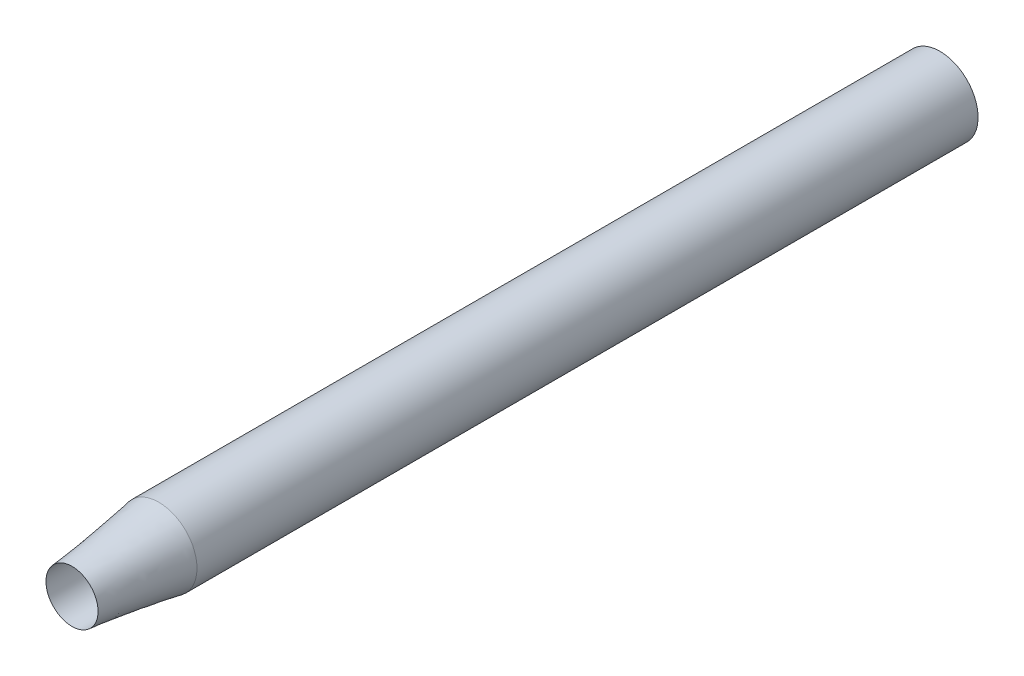
from build123d import *

# Parameters (mm, degrees)
SKETCH1_R           = 2.2
BOSS_EXTRUDE1_DEPTH = 45
SKETCH4_R           = 1.5
CUT_EXTRUDE1_DEPTH  = 51.096706487


with BuildPart() as part:
    # Sketch1 → Boss-Extrude1 (new body)
    with BuildSketch(Plane.XY):
        with Locations(Location((0, 0, 0), (0, 0, 180))):
            Circle(SKETCH1_R)
    extrude(amount=BOSS_EXTRUDE1_DEPTH)

    # Loft1: read off the stored shape, not the designer's step
    # Loft1: loft between two sections, ruled curve by curve
    loft1_from = [
        Edge.make_bspline([(-2.015197815, 0.88259717, 45), (-3.780392156, -3.14779846, 45), (0.250003475, -4.912992801, 45), (2.015197815, -0.88259717, 45), (3.780392156, 3.14779846, 45), (-0.250003475, 4.912992801, 45), (-2.015197815, 0.88259717, 45)], [0, 0, 0, 0, 0.5, 0.5, 0.5, 1, 1, 1, 1], 3, [1, 0.333333333, 0.333333333, 1, 0.333333333, 0.333333333, 1]),
    ]
    loft1_to = [
        Edge.make_bspline([(-1.498749202, -0.061244028, 50), (-1.376261146, -3.058742431, 50), (1.621237257, -2.936254375, 50), (1.498749202, 0.061244028, 50), (1.376261146, 3.058742431, 50), (-1.621237257, 2.936254375, 50), (-1.498749202, -0.061244028, 50)], [0, 0, 0, 0, 0.5, 0.5, 0.5, 1, 1, 1, 1], 3, [1, 0.333333333, 0.333333333, 1, 0.333333333, 0.333333333, 1]),
    ]
    loft1 = Solid(Shell([*[Face.make_surface_from_curves(loft1_from[k], loft1_to[k]) for k in range(1)], Face(Wire(loft1_from)), Face(Wire(loft1_to))]))
    add(loft1)

    # Sketch4 → Cut-Extrude1 (cut, through all)
    with BuildSketch(Plane.XY.offset(50)):
        Circle(SKETCH4_R)
    extrude(amount=-CUT_EXTRUDE1_DEPTH, mode=Mode.SUBTRACT)


solid = part.part
